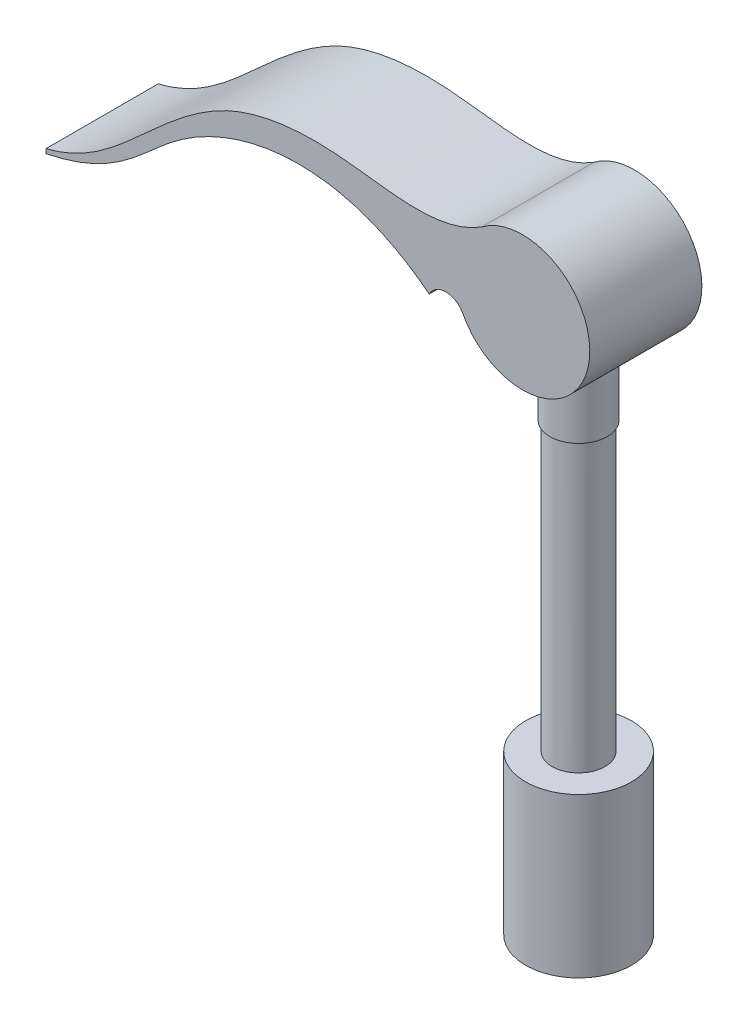
from build123d import *

# Parameters (mm, degrees)
SKETCH1_R                = 3
BOSS_EXTRUDE1_DEPTH      = 32.5
BOSS_EXTRUDE2_DEPTH      = 6.35
BOSS_EXTRUDE3_REACH      = 87.109
BOSS_EXTRUDE3_END_RADIUS = 7.62
BOSS_EXTRUDE3_START      = 18
SKETCH3_R                = 3.25
SKETCH4_R                = 6
BOSS_EXTRUDE4_DEPTH      = 18


with BuildPart() as part:
    # Sketch1 → Boss-Extrude1 (new, symmetric)
    with BuildSketch(Plane(origin=(0, 0, 0), x_dir=(1, 0, 0), z_dir=(0, 1, 0))):
        Circle(SKETCH1_R)
    extrude(amount=BOSS_EXTRUDE1_DEPTH, both=True)

    # Sketch2 → Boss-Extrude2 (add, symmetric)
    with BuildSketch(Plane.XY):
        with BuildLine():
            Line((-53.975, 20.32), (-53.975, 20.828))
            add(Edge.make_bspline(
                [(-53.975, 20.828), (-48.579084473, 22.104261863), (-42.739180184, 28.451304863), (-32.707581635, 36.217235943), (-19.445903171, 37.601432098), (-9.805142387, 34.528428283), (-4.615884318, 37.812838606)],
                knots=[0, 0, 0, 0, 0.290913355, 0.472280192, 0.684923774, 1, 1, 1, 1], degree=3))
            ThreePointArc((-4.615884318, 37.812838606), (7.434387163, 30.07838775), (-6.766850807, 28.24655453))
            ThreePointArc((-6.766850807, 28.24655453), (-8.671850807, 29.405444626), (-10.576850807, 28.24655453))
            add(Edge.make_bspline(
                [(-53.975, 20.32), (-46.121670197, 21.895048491), (-37.272795223, 34.142014089), (-20.262703733, 35.94817115), (-10.576850807, 28.24655453)],
                knots=[0, 0, 0, 0, 0.320306102, 1, 1, 1, 1], degree=3))
        make_face()
    extrude(amount=BOSS_EXTRUDE2_DEPTH, both=True)

    # Boss-Extrude3: up to this cylinder (the profile starts outside it)
    boss_extrude3_end = Plane(origin=(0, 31.75, 0), z_dir=(0, 0, -1)) * Cylinder(BOSS_EXTRUDE3_END_RADIUS, 190.458, mode=Mode.PRIVATE)
    # Sketch3 → Boss-Extrude3 (add, up to the surface)
    with BuildSketch(Plane(origin=(0, 0, 0), x_dir=(1, 0, 0), z_dir=(0, 1, 0)).offset(BOSS_EXTRUDE3_START), mode=Mode.PRIVATE) as boss_extrude3_sk1:
        Circle(SKETCH3_R)
    boss_extrude3_tool1 = extrude(boss_extrude3_sk1.sketch, amount=BOSS_EXTRUDE3_REACH, mode=Mode.PRIVATE) - boss_extrude3_end
    add(boss_extrude3_tool1.solids().sort_by_distance((0, 18, 0))[0])

    # Sketch4 → Boss-Extrude4 (add)
    with BuildSketch(Plane.XZ.offset(32.5)):
        Circle(SKETCH4_R)
    extrude(amount=-BOSS_EXTRUDE4_DEPTH)


solid = part.part
